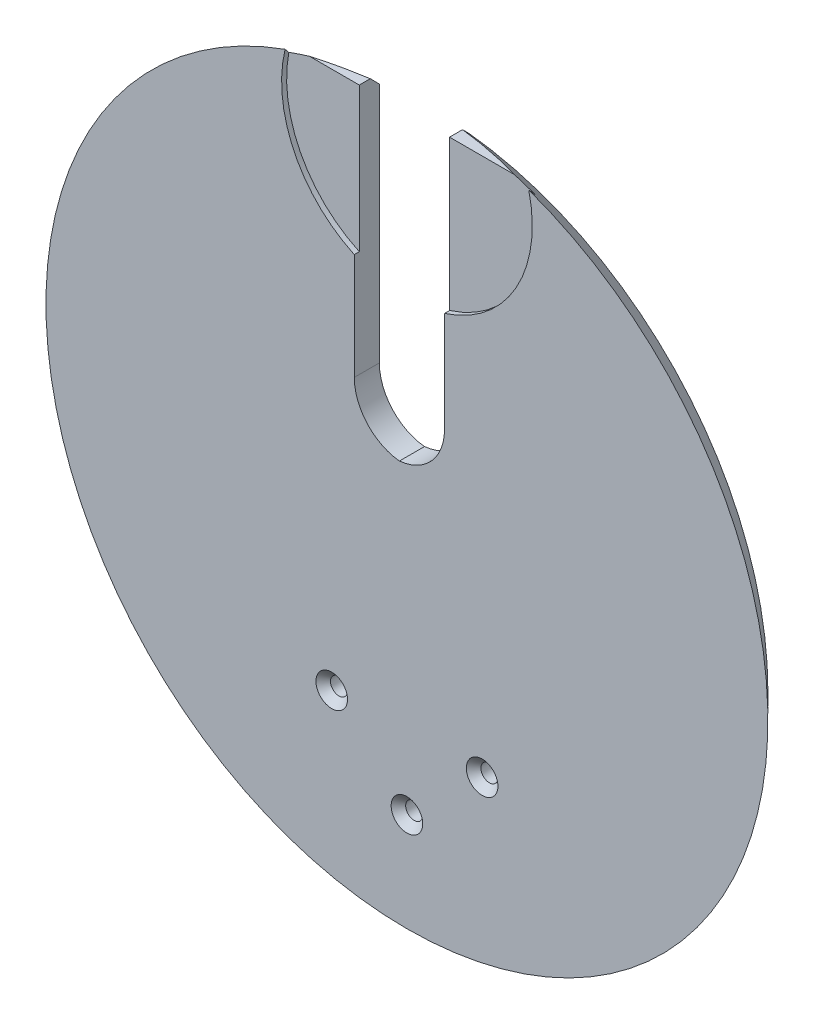
from build123d import *

# Parameters (mm, degrees)
BOSS_EXTRUDE2_DEPTH                                 = 5
CSK_FOR_M3_COUNTERSUNK_FLAT_HEAD_SCREW1_D           = 3.4
CSK_FOR_M3_COUNTERSUNK_FLAT_HEAD_SCREW1_DEPTH       = 5
CSK_FOR_M3_COUNTERSUNK_FLAT_HEAD_SCREW1_CSINK_D     = 6.3
CSK_FOR_M3_COUNTERSUNK_FLAT_HEAD_SCREW1_CSINK_ANGLE = 90
CSK_FOR_M3_COUNTERSUNK_FLAT_HEAD_SCREW1_TIP         = 1.021463052
CUT_EXTRUDE1_REACH                                  = 103.946
SKETCH4_W                                           = 18
SKETCH4_H                                           = 60
SKETCH5_R                                           = 25
CUT_EXTRUDE2_DEPTH                                  = 1
FILLET1_R                                           = 10


with BuildPart() as part:
    # Sketch1 → Boss-Extrude2 (new body)
    with BuildSketch(Plane.XY):
        with BuildLine():
            Line((-23.664319132, 68), (23.664319132, 68))
            ThreePointArc((23.664319132, 68), (0, -72), (-23.664319132, 68))
        make_face()
    extrude(amount=BOSS_EXTRUDE2_DEPTH)

    # Chamfer1: read off the stored shape, not the designer's step
    # Chamfer1 outline → Chamfer1 (revolve, cut)
    with BuildSketch(Plane.XZ):
        Polygon((72.000000172, 5.000000172), (67, 0), (72.000000172, 0), align=None)
    revolve(axis=Axis((0, 0, 0), (0, 0, 1)), mode=Mode.SUBTRACT)

    # CSK for M3 Countersunk Flat Head Screw1
    with Locations(Plane.XY.offset(5)):
        with Locations((15, -38.31), (-15, -38.31), (0, -52.31)):
            CounterSinkHole(CSK_FOR_M3_COUNTERSUNK_FLAT_HEAD_SCREW1_D / 2, CSK_FOR_M3_COUNTERSUNK_FLAT_HEAD_SCREW1_CSINK_D / 2, depth=CSK_FOR_M3_COUNTERSUNK_FLAT_HEAD_SCREW1_DEPTH, counter_sink_angle=CSK_FOR_M3_COUNTERSUNK_FLAT_HEAD_SCREW1_CSINK_ANGLE)
            with Locations((0, 0, -(CSK_FOR_M3_COUNTERSUNK_FLAT_HEAD_SCREW1_DEPTH + CSK_FOR_M3_COUNTERSUNK_FLAT_HEAD_SCREW1_TIP / 2))):  # 118° drill point
                Cone(0, CSK_FOR_M3_COUNTERSUNK_FLAT_HEAD_SCREW1_D / 2, CSK_FOR_M3_COUNTERSUNK_FLAT_HEAD_SCREW1_TIP, mode=Mode.SUBTRACT)

    # Cut-Extrude1: up to this face of the body (flat: up to its plane)
    cut_extrude1_end = Plane(part.part.faces().sort_by_distance((0, 0.083165236, 0))[0])
    # Sketch4 → Cut-Extrude1 (cut, up to the picked face)
    with BuildSketch(Plane.XY.offset(5), mode=Mode.PRIVATE) as cut_extrude1_sk1:
        with Locations((-1.5, 38)):
            Rectangle(SKETCH4_W, SKETCH4_H)
    cut_extrude1_tool1 = split(extrude(cut_extrude1_sk1.sketch, amount=-CUT_EXTRUDE1_REACH, mode=Mode.PRIVATE), bisect_by=cut_extrude1_end, keep=Keep.BOTH, mode=Mode.PRIVATE)
    add(cut_extrude1_tool1.solids().sort_by(Axis((-1.5, 38, 5), (0, 0, -1)))[0], mode=Mode.SUBTRACT)

    # Sketch5 → Cut-Extrude2 (cut)
    with BuildSketch(Plane.XY.offset(5)):
        with Locations((0, 61.9)):
            Circle(SKETCH5_R)
    extrude(amount=-CUT_EXTRUDE2_DEPTH, mode=Mode.SUBTRACT)

    # Fillet1
    # the kernel refuses this fillet: 10 mm, written as the material it adds along each edge
    with BuildSketch(Plane(origin=(-10.5, 8, 5), x_dir=(1, 0, 0), z_dir=(0, 0, -1)), Plane(origin=(7.5, 8, 5), x_dir=(0, 1, 0), z_dir=(0, 0, -1))) as fillet1_piece_1:
        with BuildLine():
            CenterArc((FILLET1_R, -FILLET1_R), FILLET1_R, 90, 90)
            Line((0, -FILLET1_R), (0, 0))
            Line((0, 0), (FILLET1_R, 0))
        make_face()
    extrude(amount=5)


solid = part.part
